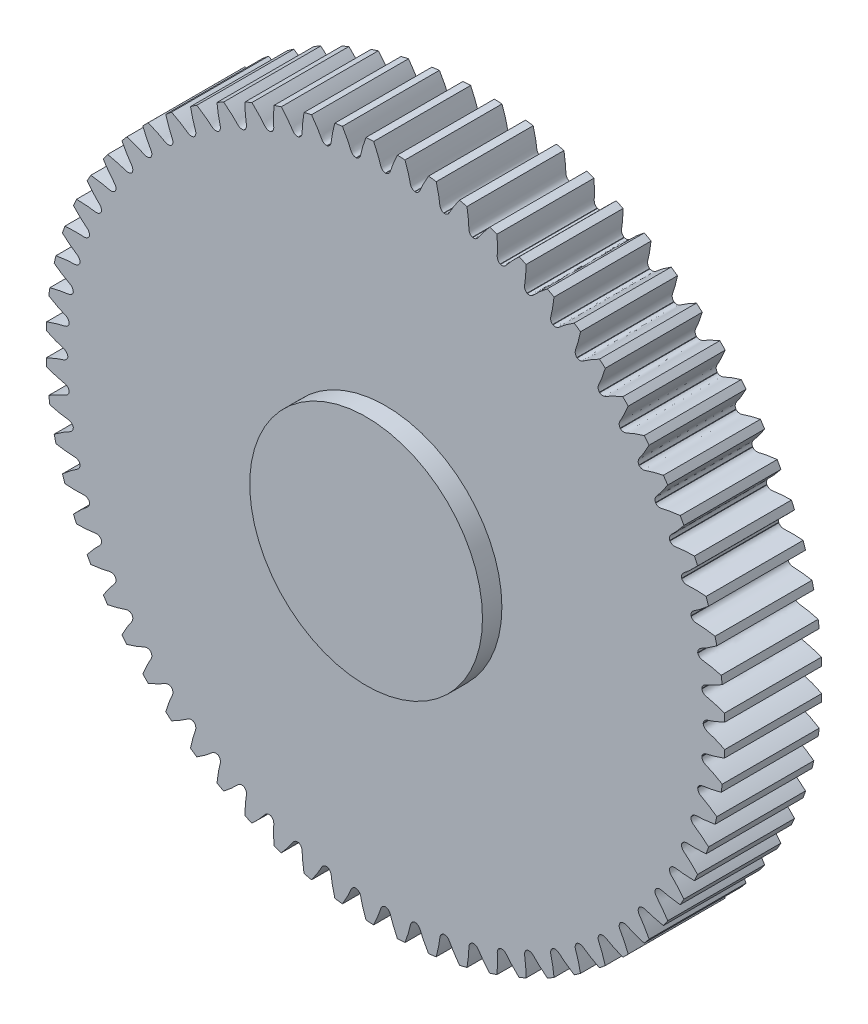
from build123d import *

# Parameters (mm, degrees)
SKETCH_1_R               = 17.5
EXTRUDE_1_DEPTH          = 5
CUT_EXTRUDE_1_DEPTH      = 26.248762346
PATTERN_CIRCULAR_1_COUNT = 68
SKETCH_4_R               = 6
EXTRUDE_2_DEPTH          = 1


with BuildPart() as part:
    # 草图1 → 凸台-拉伸1 (new body)
    with BuildSketch(Plane.XY):
        Circle(SKETCH_1_R)
    extrude(amount=EXTRUDE_1_DEPTH)

    # 草图2 → 切除-拉伸1 (cut, through all)
    with BuildSketch(Plane.XY):
        with BuildLine():
            ThreePointArc((0.01, 16.374912326), (0, 16.37491538), (-0.01, 16.374912326))
            add(Edge.make_bspline(
                [(-0.01, 16.374912326), (-0.21512999, 16.419868087), (-0.252409526, 16.603129241), (-0.32375493, 16.809834561), (-0.360217199, 16.911437673), (-0.401195645, 17.018135101), (-0.446645427, 17.129947827), (-0.496863015, 17.2466897), (-0.552040549, 17.368226214), (-0.612395245, 17.494399358), (-0.678131675, 17.625049517), (-0.74945243, 17.760009291), (-0.826554833, 17.899105412), (-0.909631658, 18.042158351), (-0.99887071, 18.188982581), (-1.094454738, 18.33938666), (-1.196561248, 18.493173379), (-1.305362357, 18.650139885), (-1.421024633, 18.810077823), (-1.543708945, 18.972773479), (-1.673570328, 19.138007921), (-1.810757779, 19.305557154), (-2.006397492, 19.534978874), (-2.160461917, 19.704897331), (-2.266792542, 19.817684865)],
                knots=[0, 0, 0, 0, 0.107618114, 0.132040288, 0.157999665, 0.185496246, 0.21453003, 0.245101019, 0.277209211, 0.310854607, 0.346037207, 0.38275701, 0.421014018, 0.460808229, 0.502139644, 0.545008262, 0.589414085, 0.635357111, 0.682837341, 0.731854775, 0.782409412, 0.834501253, 0.888130298, 1, 1, 1, 1], degree=3))
            ThreePointArc((-2.266792542, 19.817684865), (0, 19.946904067), (2.266792542, 19.817684865))
            add(Edge.make_bspline(
                [(0.01, 16.374912326), (0.21512999, 16.419868087), (0.252409526, 16.603129241), (0.32375493, 16.809834561), (0.360217199, 16.911437673), (0.401195645, 17.018135101), (0.446645427, 17.129947827), (0.496863015, 17.2466897), (0.552040549, 17.368226214), (0.612395245, 17.494399358), (0.678131675, 17.625049517), (0.74945243, 17.760009291), (0.826554833, 17.899105412), (0.909631658, 18.042158351), (0.99887071, 18.188982581), (1.094454738, 18.33938666), (1.196561248, 18.493173379), (1.305362357, 18.650139885), (1.421024633, 18.810077823), (1.543708945, 18.972773479), (1.673570328, 19.138007921), (1.810757779, 19.305557154), (2.006397492, 19.534978874), (2.160461917, 19.704897331), (2.266792542, 19.817684865)],
                knots=[0, 0, 0, 0, 0.107618114, 0.132040288, 0.157999665, 0.185496246, 0.21453003, 0.245101019, 0.277209211, 0.310854607, 0.346037207, 0.38275701, 0.421014018, 0.460808229, 0.502139644, 0.545008262, 0.589414085, 0.635357111, 0.682837341, 0.731854775, 0.782409412, 0.834501253, 0.888130298, 1, 1, 1, 1], degree=3))
        make_face()
    cut_extrude_1 = extrude(amount=CUT_EXTRUDE_1_DEPTH, mode=Mode.SUBTRACT)

    # 阵列(圆周)1: 切除-拉伸1 ×68 about axis
    pattern_circular_1_axis = Axis((0, 0, 5), (0, 0, -1))
    for i in range(1, PATTERN_CIRCULAR_1_COUNT):
        add(cut_extrude_1.rotate(pattern_circular_1_axis, i * 360 / PATTERN_CIRCULAR_1_COUNT), mode=Mode.SUBTRACT)

    # 草图4 → 凸台-拉伸2 (add)
    with BuildSketch(Plane.XY.offset(5)):
        Circle(SKETCH_4_R)
    extrude(amount=EXTRUDE_2_DEPTH)


solid = part.part
